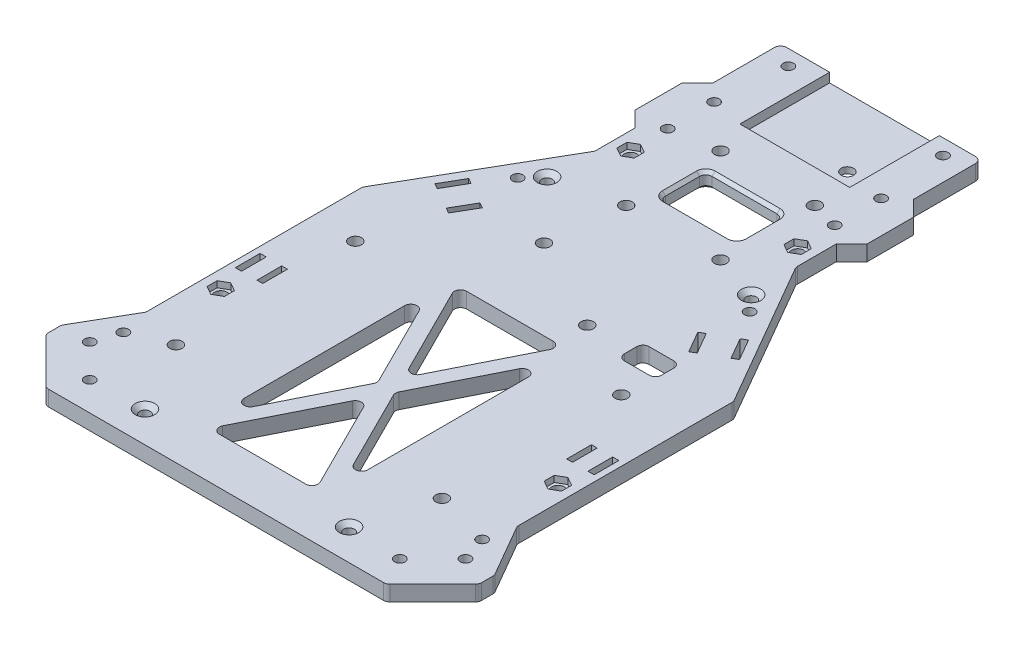
from build123d import *

# Parameters (mm, degrees)
SKETCH1_W                                       = 140
SKETCH1_H                                       = 220
BOSS_EXTRUDE1_DEPTH                             = 5
F_4_0_4_DIAMETER_HOLE1_D                        = 4
CUT_EXTRUDE1_DEPTH                              = 5
CHAMFER3_SIZE                                   = 15
CSK_FOR_M3_FLAT_HEAD_MACHINE_SCREW4_D           = 3.4
CSK_FOR_M3_FLAT_HEAD_MACHINE_SCREW4_DEPTH       = 5
CSK_FOR_M3_FLAT_HEAD_MACHINE_SCREW4_CSINK_D     = 6.3
CSK_FOR_M3_FLAT_HEAD_MACHINE_SCREW4_CSINK_ANGLE = 90
CSK_FOR_M3_FLAT_HEAD_MACHINE_SCREW4_TIP         = 1.021463052
SKETCH18_W                                      = 95.00926462
SKETCH18_H                                      = 15.610376511
CUT_EXTRUDE2_DEPTH                              = 5
CUT_EXTRUDE5_DEPTH                              = 2
CSK_FOR_M3_FLAT_HEAD_MACHINE_SCREW3_D           = 3.4
CSK_FOR_M3_FLAT_HEAD_MACHINE_SCREW3_CSINK_D     = 6.3
CSK_FOR_M3_FLAT_HEAD_MACHINE_SCREW3_CSINK_ANGLE = 90
CUT_EXTRUDE10_DEPTH                             = 131.479883507
FILLET1_R                                       = 2
F_4_0_4_DIAMETER_HOLE8_D                        = 4
CUT_EXTRUDE11_DEPTH                             = 10
FILLET2_R                                       = 2
SKETCH38_W                                      = 2
SKETCH38_H                                      = 8
SKETCH38_W_2                                    = 1.864345839
CUT_EXTRUDE13_DEPTH                             = 131.479883507
CSK_FOR_M3_FLAT_HEAD_MACHINE_SCREW2_D           = 3.4
CSK_FOR_M3_FLAT_HEAD_MACHINE_SCREW2_CSINK_D     = 6.3
CSK_FOR_M3_FLAT_HEAD_MACHINE_SCREW2_CSINK_ANGLE = 90
SKETCH41_W                                      = 35.5
SKETCH41_H                                      = 29
CUT_EXTRUDE14_DEPTH                             = 3
F_4_0_4_DIAMETER_HOLE10_D                       = 4
F_4_0_4_DIAMETER_HOLE10_DEPTH                   = 10
F_4_0_4_DIAMETER_HOLE10_TIP                     = 1.201721238
F_4_0_4_DIAMETER_HOLE11_D                       = 4
F_4_0_4_DIAMETER_HOLE11_DEPTH                   = 10
F_4_0_4_DIAMETER_HOLE11_TIP                     = 1.201721238
CUT_EXTRUDE15_DEPTH                             = 2
F_4_0_4_DIAMETER_HOLE12_D                       = 4
CUT_EXTRUDE16_DEPTH                             = 2
CSK_FOR_M3_FLAT_HEAD_MACHINE_SCREW1_D           = 3.4
CSK_FOR_M3_FLAT_HEAD_MACHINE_SCREW1_DEPTH       = 5
CSK_FOR_M3_FLAT_HEAD_MACHINE_SCREW1_CSINK_D     = 6.3
CSK_FOR_M3_FLAT_HEAD_MACHINE_SCREW1_CSINK_ANGLE = 90
CSK_FOR_M3_FLAT_HEAD_MACHINE_SCREW1_TIP         = 1.021463052
BOSS_EXTRUDE2_DEPTH                             = 5
CUT_EXTRUDE17_DEPTH                             = 2
SKETCH56_W                                      = 25
SKETCH56_H                                      = 15
CUT_EXTRUDE18_DEPTH                             = 131.479883507
FILLET3_R                                       = 2
CHAMFER5_SIZE                                   = 1
SKETCH57_W                                      = 12
SKETCH57_H                                      = 8
CUT_EXTRUDE19_DEPTH                             = 131.479883507
FILLET4_R                                       = 2


with BuildPart() as part:
    # Sketch1 → Boss-Extrude1 (new body)
    with BuildSketch(Plane(origin=(0, 0, 0), x_dir=(1, 0, 0), z_dir=(0, 1, 0))):
        Rectangle(SKETCH1_W, SKETCH1_H)
    extrude(amount=BOSS_EXTRUDE1_DEPTH)

    # Ø4.0 (4) Diameter Hole1 (through all)
    with Locations(Plane(origin=(0, 5, 0), x_dir=(1, 0, 0), z_dir=(0, 1, 0))):
        with Locations((-12.25, 34.825046934), (-12.25, 65.325046934), (18.25, 65.325046934), (18.25, 34.825046934)):
            Hole(F_4_0_4_DIAMETER_HOLE1_D / 2)

    # Sketch8 → Cut-Extrude1 (cut)
    with BuildSketch(Plane(origin=(0, 5, 0), x_dir=(1, 0, 0), z_dir=(0, 1, 0))):
        Polygon((-70, 110), (-32.5, 110), (-32.5, 44.951905284), (-70, -20), align=None)
        Polygon((70, 110), (70, -20), (32.5, 44.951905284), (32.5, 110), align=None)
    extrude(amount=-CUT_EXTRUDE1_DEPTH, mode=Mode.SUBTRACT)

    # Chamfer3
    chamfer3_edges = [part.edges().sort_by_distance(p)[0] for p in [
        (70, 2.5, 110),
        (-70, 2.5, 110),
    ]]
    chamfer(chamfer3_edges, length=CHAMFER3_SIZE)

    # CSK for M3 Flat Head Machine Screw4
    with Locations(Plane.XZ):
        with Locations((37.5, -25), (-37.5, -25), (-25, -100), (25, -100)):
            CounterSinkHole(CSK_FOR_M3_FLAT_HEAD_MACHINE_SCREW4_D / 2, CSK_FOR_M3_FLAT_HEAD_MACHINE_SCREW4_CSINK_D / 2, depth=CSK_FOR_M3_FLAT_HEAD_MACHINE_SCREW4_DEPTH, counter_sink_angle=CSK_FOR_M3_FLAT_HEAD_MACHINE_SCREW4_CSINK_ANGLE)
            with Locations((0, 0, -(CSK_FOR_M3_FLAT_HEAD_MACHINE_SCREW4_DEPTH + CSK_FOR_M3_FLAT_HEAD_MACHINE_SCREW4_TIP / 2))):  # 118° drill point
                Cone(0, CSK_FOR_M3_FLAT_HEAD_MACHINE_SCREW4_D / 2, CSK_FOR_M3_FLAT_HEAD_MACHINE_SCREW4_TIP, mode=Mode.SUBTRACT)

    # Sketch18 → Cut-Extrude2 (cut)
    with BuildSketch(Plane(origin=(0, 5, 0), x_dir=(1, 0, 0), z_dir=(0, 1, 0))):
        with Locations((-6.838700294, 112.805188256)):
            Rectangle(SKETCH18_W, SKETCH18_H)
    extrude(amount=-CUT_EXTRUDE2_DEPTH, mode=Mode.SUBTRACT)

    # Sketch21 → Cut-Extrude5 (cut)
    with BuildSketch(Plane.XZ):
        Polygon((-9.016838493, -65.325046934), (-10.633419246, -62.525046934), (-13.866580754, -62.525046934), (-15.483161507, -65.325046934), (-13.866580754, -68.125046934), (-10.633419246, -68.125046934), align=None)
        Polygon((-10.633419246, -32.025046934), (-9.016838493, -34.825046934), (-10.633419246, -37.625046934), (-13.866580754, -37.625046934), (-15.483161507, -34.825046934), (-13.866580754, -32.025046934), align=None)
        Polygon((16.633419246, -68.125046934), (15.016838493, -65.325046934), (16.633419246, -62.525046934), (19.866580754, -62.525046934), (21.483161507, -65.325046934), (19.866580754, -68.125046934), align=None)
        Polygon((15.016838493, -34.825046934), (16.633419246, -37.625046934), (19.866580754, -37.625046934), (21.483161507, -34.825046934), (19.866580754, -32.025046934), (16.633419246, -32.025046934), align=None)
    extrude(amount=-CUT_EXTRUDE5_DEPTH, mode=Mode.SUBTRACT)

    # CSK for M3 Flat Head Machine Screw3 (through all)
    with Locations(Plane.XZ):
        with Locations((-58, 82), (58, 82)):
            CounterSinkHole(CSK_FOR_M3_FLAT_HEAD_MACHINE_SCREW3_D / 2, CSK_FOR_M3_FLAT_HEAD_MACHINE_SCREW3_CSINK_D / 2, counter_sink_angle=CSK_FOR_M3_FLAT_HEAD_MACHINE_SCREW3_CSINK_ANGLE)

    # Sketch32 → Cut-Extrude10 (cut, through all)
    with BuildSketch(Plane.XZ):
        Polygon((0, 60.590169944), (17.204915028, 95), (-17.204915028, 95), align=None)
        Polygon((-20, 89.409830056), (-20, 20.590169944), (-15.941897446, 28.706375051), (-2.795084972, 55), align=None)
        Polygon((2.795084972, 55), (20, 20.590169944), (20, 89.409830056), align=None)
        Polygon((-17.204915028, 15), (17.204915028, 15), (0, 49.409830056), (-11.469761491, 26.470307074), align=None)
    extrude(amount=-CUT_EXTRUDE10_DEPTH, mode=Mode.SUBTRACT)

    # Fillet1
    fillet1_edges = [part.edges().sort_by_distance(p)[0] for p in [
        (-20, 2.5, 89.409830056),
        (-2.795084972, 2.5, 55),
        (-20, 2.5, 20.590169944),
        (20, 2.5, 20.590169944),
        (2.795084972, 2.5, 55),
        (20, 2.5, 89.409830056),
        (17.204915028, 2.5, 15),
        (-17.204915028, 2.5, 15),
        (0, 2.5, 49.409830056),
        (17.204915028, 2.5, 95),
        (0, 2.5, 60.590169944),
        (-17.204915028, 2.5, 95),
    ]]
    fillet(fillet1_edges, radius=FILLET1_R)

    # Ø4.0 (4) Diameter Hole8 (through all)
    with Locations(Plane(origin=(0, 5, 0), x_dir=(1, 0, 0), z_dir=(0, 1, 0))):
        with Locations((-46, -19), (40, -19), (40, -77), (-46, -77)):
            Hole(F_4_0_4_DIAMETER_HOLE8_D / 2)

    # Sketch36 → Cut-Extrude11 (cut)
    with BuildSketch(Plane(origin=(0, 5, 0), x_dir=(1, 0, 0), z_dir=(0, 1, 0))):
        Polygon((-60, -2.679491924), (-60, -72.679491924), (-70, -90), (-70, -20), align=None)
        Polygon((70, -20), (70, -90), (60, -72.679491924), (60, -2.679491924), align=None)
    extrude(amount=-CUT_EXTRUDE11_DEPTH, mode=Mode.SUBTRACT)

    # Fillet2
    fillet2_edges = [part.edges().sort_by_distance(p)[0] for p in [
        (-32.5, 2.5, -105),
        (32.5, 2.5, -105),
        (-60, 2.5, 2.679491924),
        (60, 2.5, 2.679491924),
        (-60, 2.5, 72.679491924),
        (-70, 2.5, 90),
        (70, 2.5, 90),
        (60, 2.5, 72.679491924),
        (-32.5, 2.5, -44.951905284),
        (32.5, 2.5, -44.951905284),
        (70, 2.5, 95),
        (-55, 2.5, 110),
        (55, 2.5, 110),
        (-70, 2.5, 95),
    ]]
    fillet(fillet2_edges, radius=FILLET2_R)

    # Sketch38 → Cut-Extrude13 (cut, through all)
    with BuildSketch(Plane.XZ):
        Polygon((-49.228018952, -9.978126549), (-45.228018952, -16.906329779), (-43.495968144, -15.906329779), (-47.495968144, -8.978126549), align=None)
        with Locations((-57, 41.789081823)):
            Rectangle(SKETCH38_W, SKETCH38_H)
        with Locations((57, 41.789081823)):
            Rectangle(SKETCH38_W, SKETCH38_H)
        Polygon((47.495968144, -8.978126549), (49.228018952, -9.978126549), (45.228018952, -16.906329779), (43.495968144, -15.906329779), align=None)
        Polygon((-40.567764914, -4.978126549), (-38.835714106, -3.978126549), (-34.835714106, -10.906329779), (-36.567764914, -11.906329779), align=None)
        Polygon((38.835714106, -3.978126549), (34.835714106, -10.906329779), (36.567764914, -11.906329779), (40.567764914, -4.978126549), align=None)
        with Locations((50.067827081, 41.789081823)):
            Rectangle(SKETCH38_W_2, SKETCH38_H)
        with Locations((-50.067827081, 41.789081823)):
            Rectangle(SKETCH38_W_2, SKETCH38_H)
    extrude(amount=-CUT_EXTRUDE13_DEPTH, mode=Mode.SUBTRACT)

    # CSK for M3 Flat Head Machine Screw2 (through all)
    with Locations(Plane(origin=(0, 5, 0), x_dir=(-1, 0, 0), z_dir=(0, 1, 0))):
        with Locations((-33, 100), (33, -30), (33, 100), (-33, -30)):
            CounterSinkHole(CSK_FOR_M3_FLAT_HEAD_MACHINE_SCREW2_D / 2, CSK_FOR_M3_FLAT_HEAD_MACHINE_SCREW2_CSINK_D / 2, counter_sink_angle=CSK_FOR_M3_FLAT_HEAD_MACHINE_SCREW2_CSINK_ANGLE)

    # Sketch41 → Cut-Extrude14 (cut)
    with BuildSketch(Plane.XZ.offset(-5)):
        with Locations((1.1, -90.5)):
            Rectangle(SKETCH41_W, SKETCH41_H)
    extrude(amount=CUT_EXTRUDE14_DEPTH, mode=Mode.SUBTRACT)

    # Ø4.0 (4) Diameter Hole10
    with Locations(Plane(origin=(0, 0, 0), x_dir=(-1, 0, 0), z_dir=(0, -1, 0))):
        with Locations((-11.1, 83)):
            Hole(F_4_0_4_DIAMETER_HOLE10_D / 2, depth=F_4_0_4_DIAMETER_HOLE10_DEPTH)
            with Locations((0, 0, -(F_4_0_4_DIAMETER_HOLE10_DEPTH + F_4_0_4_DIAMETER_HOLE10_TIP / 2))):  # 118° drill point
                Cone(0, F_4_0_4_DIAMETER_HOLE10_D / 2, F_4_0_4_DIAMETER_HOLE10_TIP, mode=Mode.SUBTRACT)

    # Ø4.0 (4) Diameter Hole11
    with Locations(Plane(origin=(0, 5, 0), x_dir=(1, 0, 0), z_dir=(0, 1, 0))):
        with Locations((15, -5), (-15, 11)):
            Hole(F_4_0_4_DIAMETER_HOLE11_D / 2, depth=F_4_0_4_DIAMETER_HOLE11_DEPTH)
            with Locations((0, 0, -(F_4_0_4_DIAMETER_HOLE11_DEPTH + F_4_0_4_DIAMETER_HOLE11_TIP / 2))):  # 118° drill point
                Cone(0, F_4_0_4_DIAMETER_HOLE11_D / 2, F_4_0_4_DIAMETER_HOLE11_TIP, mode=Mode.SUBTRACT)

    # Sketch49 → Cut-Extrude15 (cut)
    with BuildSketch(Plane.XZ):
        Polygon((-11.766838493, -11), (-13.383419246, -8.2), (-16.616580754, -8.2), (-18.233161507, -11), (-16.616580754, -13.8), (-13.383419246, -13.8), align=None)
        Polygon((18.233161507, 5), (16.616580754, 7.8), (13.383419246, 7.8), (11.766838493, 5), (13.383419246, 2.2), (16.616580754, 2.2), align=None)
    extrude(amount=-CUT_EXTRUDE15_DEPTH, mode=Mode.SUBTRACT)

    # Ø4.0 (4) Diameter Hole12 (through all)
    with Locations(Plane(origin=(0, 5, 0), x_dir=(1, 0, 0), z_dir=(0, 1, 0))):
        with Locations((27, 51), (54.5, -54)):
            f_4_0_4_diameter_hole12 = Hole(F_4_0_4_DIAMETER_HOLE12_D / 2)

    # Mirror1: Ø4.0 (4) Diameter Hole12 across plane
    add(f_4_0_4_diameter_hole12.mirror(Plane(origin=(0, 0, 0), x_dir=(0, 0, 1), z_dir=(1, 0, 0))), mode=Mode.SUBTRACT)

    # Sketch52 → Cut-Extrude16 (cut)
    with BuildSketch(Plane(origin=(0, 5, 0), x_dir=(1, 0, 0), z_dir=(0, 1, 0))):
        Polygon((29.8, 49.383419246), (29.8, 52.616580754), (27, 54.233161507), (24.2, 52.616580754), (24.2, 49.383419246), (27, 47.766838493), align=None)
        Polygon((57.3, -55.616580754), (57.3, -52.383419246), (54.5, -50.766838493), (51.7, -52.383419246), (51.7, -55.616580754), (54.5, -57.233161507), align=None)
        Polygon((-54.5, -57.233161507), (-57.3, -55.616580754), (-57.3, -52.383419246), (-54.5, -50.766838493), (-51.7, -52.383419246), (-51.7, -55.616580754), align=None)
        Polygon((-27, 47.766838493), (-29.8, 49.383419246), (-29.8, 52.616580754), (-27, 54.233161507), (-24.2, 52.616580754), (-24.2, 49.383419246), align=None)
    extrude(amount=-CUT_EXTRUDE16_DEPTH, mode=Mode.SUBTRACT)

    # CSK for M3 Flat Head Machine Screw1
    with Locations(Plane(origin=(0, 0, 0), x_dir=(-1, 0, 0), z_dir=(0, -1, 0))):
        with Locations((27, 78), (27, 63), (-27, 63), (-27, 78), (50.125631329, -100.732233047), (60.732233047, -90.125631329), (-50.125631329, -100.732233047), (-60.732233047, -90.125631329)):
            CounterSinkHole(CSK_FOR_M3_FLAT_HEAD_MACHINE_SCREW1_D / 2, CSK_FOR_M3_FLAT_HEAD_MACHINE_SCREW1_CSINK_D / 2, depth=CSK_FOR_M3_FLAT_HEAD_MACHINE_SCREW1_DEPTH, counter_sink_angle=CSK_FOR_M3_FLAT_HEAD_MACHINE_SCREW1_CSINK_ANGLE)
            with Locations((0, 0, -(CSK_FOR_M3_FLAT_HEAD_MACHINE_SCREW1_DEPTH + CSK_FOR_M3_FLAT_HEAD_MACHINE_SCREW1_TIP / 2))):  # 118° drill point
                Cone(0, CSK_FOR_M3_FLAT_HEAD_MACHINE_SCREW1_D / 2, CSK_FOR_M3_FLAT_HEAD_MACHINE_SCREW1_TIP, mode=Mode.SUBTRACT)

    # Sketch45 → Boss-Extrude2 (add, through all)
    with BuildSketch(Plane(origin=(0, 5, 0), x_dir=(1, 0, 0), z_dir=(0, 1, 0))):
        Polygon((-37.5, 63), (-37.5, 78), (-32.5, 83), (-32.5, 58), align=None)
        Polygon((37.5, 63), (32.5, 58), (32.5, 83), (37.5, 78), align=None)
    extrude(amount=-BOSS_EXTRUDE2_DEPTH)

    # Sketch55 → Cut-Extrude17 (cut)
    with BuildSketch(Plane.XZ):
        Polygon((37.2, 17.383419246), (37.2, 20.616580754), (40, 22.233161507), (42.8, 20.616580754), (42.8, 17.383419246), (40, 15.766838493), align=None)
        Polygon((-42.766838493, 77), (-44.383419246, 79.8), (-47.616580754, 79.8), (-49.233161507, 77), (-47.616580754, 74.2), (-44.383419246, 74.2), align=None)
        Polygon((-43.2, 20.616580754), (-46, 22.233161507), (-48.8, 20.616580754), (-48.8, 17.383419246), (-46, 15.766838493), (-43.2, 17.383419246), align=None)
        Polygon((38.383419246, 74.2), (36.766838493, 77), (38.383419246, 79.8), (41.616580754, 79.8), (43.233161507, 77), (41.616580754, 74.2), align=None)
    extrude(amount=-CUT_EXTRUDE17_DEPTH, mode=Mode.SUBTRACT)

    # Sketch56 → Cut-Extrude18 (cut, through all)
    with BuildSketch(Plane(origin=(0, 5, 0), x_dir=(1, 0, 0), z_dir=(0, 1, 0))):
        with Locations((3, 50.325046934)):
            Rectangle(SKETCH56_W, SKETCH56_H)
    extrude(amount=-CUT_EXTRUDE18_DEPTH, mode=Mode.SUBTRACT)

    # Fillet3
    fillet3_edges = [part.edges().sort_by_distance(p)[0] for p in [
        (15.5, 2.5, -57.825046934),
        (15.5, 2.5, -42.825046934),
        (-9.5, 2.5, -42.825046934),
        (-9.5, 2.5, -57.825046934),
    ]]
    fillet(fillet3_edges, radius=FILLET3_R)

    # Chamfer5
    chamfer5_edges = [part.edges().sort_by_distance(p)[0] for p in [
        (14.914213562, 0, -43.410833371),
        (-8.914213562, 5, -57.239260496),
        (-8.914213562, 0, -57.239260496),
        (3, 5, -42.825046934),
        (3, 0, -42.825046934),
        (-9.5, 5, -50.325046934),
        (-9.5, 0, -50.325046934),
        (3, 5, -57.825046934),
        (3, 0, -57.825046934),
        (15.5, 5, -50.325046934),
        (15.5, 0, -50.325046934),
        (-8.914213562, 5, -43.410833371),
        (-8.914213562, 0, -43.410833371),
        (14.914213562, 5, -57.239260496),
        (14.914213562, 0, -57.239260496),
        (14.914213562, 5, -43.410833371),
    ]]
    chamfer(chamfer5_edges, length=CHAMFER5_SIZE)

    # Sketch57 → Cut-Extrude19 (cut, through all)
    with BuildSketch(Plane(origin=(0, 5, 0), x_dir=(1, 0, 0), z_dir=(0, 1, 0))):
        with Locations((35, -5)):
            Rectangle(SKETCH57_W, SKETCH57_H)
    extrude(amount=-CUT_EXTRUDE19_DEPTH, mode=Mode.SUBTRACT)

    # Fillet4
    fillet4_edges = [part.edges().sort_by_distance(p)[0] for p in [
        (41, 2.5, 1),
        (41, 2.5, 9),
        (29, 2.5, 9),
        (29, 2.5, 1),
    ]]
    fillet(fillet4_edges, radius=FILLET4_R)


solid = part.part
